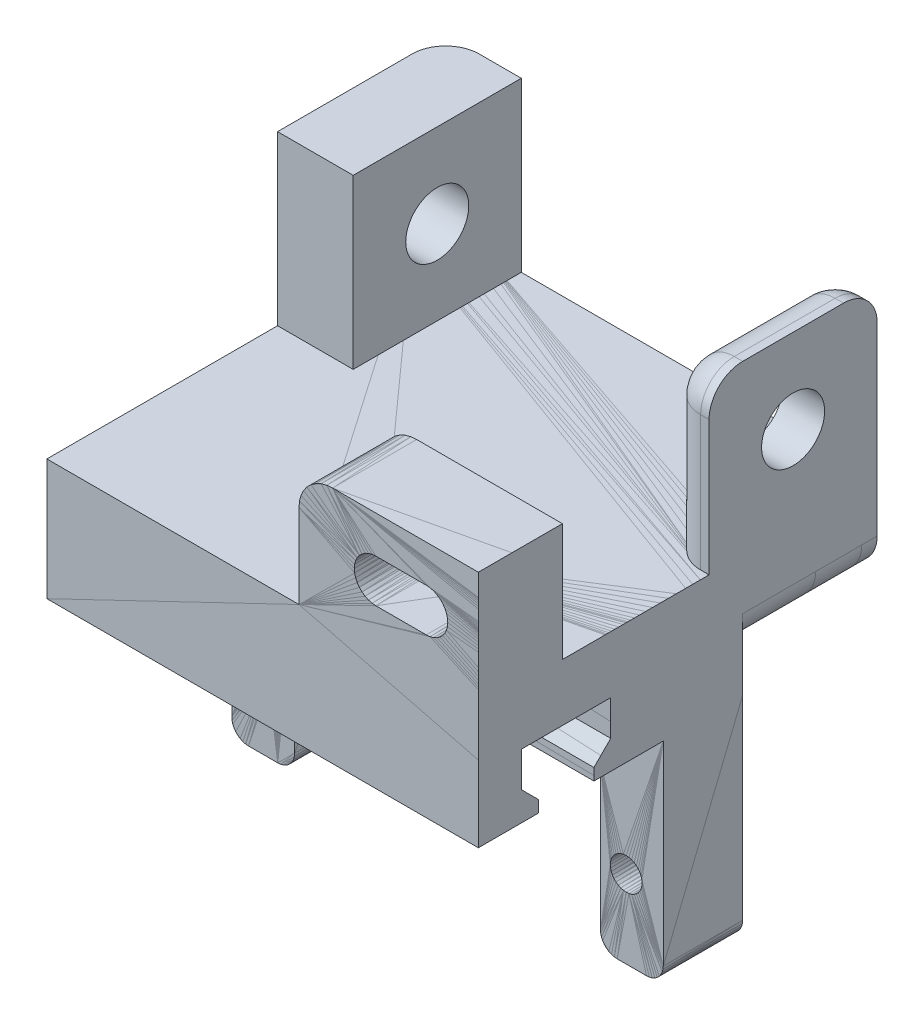
from build123d import *

# Parameters (mm, degrees)
CUT_EXTRUDE1_START       = 2.540050074
CUT_EXTRUDE1_OUTLINE_W   = 32.600000501
CUT_EXTRUDE1_OUTLINE_H   = 4.317998886
CUT_EXTRUDE1_DEPTH       = 27.590001002
CUT_EXTRUDE1_START_2     = 10.160050355
CUT_EXTRUDE1_2_DEPTH     = 6.000001915
CUT_EXTRUDE1_START_3     = 26.859140024
CUT_EXTRUDE1_3_OUTLINE_W = 32.600000501
CUT_EXTRUDE1_3_OUTLINE_H = 4.825999961
CUT_EXTRUDE1_3_DEPTH     = 3.270911052
CUT_EXTRUDE1_4_OUTLINE_W = 32.600000501
CUT_EXTRUDE1_4_OUTLINE_H = 2.032000572
CUT_EXTRUDE1_4_DEPTH     = 17.588090152
CUT_EXTRUDE1_START_4     = 16.16005227
CUT_EXTRUDE1_5_OUTLINE_W = 32.600000501
CUT_EXTRUDE1_5_OUTLINE_H = 2.793999389
CUT_EXTRUDE1_5_DEPTH     = 3.968087956
CUT_EXTRUDE1_START_5     = 23.780049756
CUT_EXTRUDE1_6_DEPTH     = 3.079090268
CUT_EXTRUDE1_START_6     = 78.40000093
CUT_EXTRUDE1_7_DEPTH     = 32.600000501
CUT_EXTRUDE1_START_7     = 19.86999996
CUT_EXTRUDE1_8_DEPTH     = 6.349999458
SKETCH2_W                = 3.175
SKETCH2_H                = 12.7
BOSS_EXTRUDE1_DEPTH      = 12.7
SKETCH3_R                = 2.38125
CUT_EXTRUDE2_DEPTH       = 40.64
FILLET1_R                = 2.54
FILLET2_R                = 2.54


with BuildPart() as part:
    # Cut-Extrude1: read off the stored shape, not the designer's step
    # Cut-Extrude1 outline → Cut-Extrude1 (new body)
    with BuildSketch(Plane.XY.offset(CUT_EXTRUDE1_START)):
        with Locations((94.700001181, 24.060999975)):
            Rectangle(CUT_EXTRUDE1_OUTLINE_W, CUT_EXTRUDE1_OUTLINE_H)
    extrude(amount=CUT_EXTRUDE1_DEPTH)

    # Cut-Extrude1 2 outline → Cut-Extrude1 2 (add)
    with BuildSketch(Plane.XY.offset(CUT_EXTRUDE1_START_2)):
        Polygon((111.000001431, 21.902000532), (78.40000093, 21.902000532), (78.40000093, 2.355000004), (78.419297934, 2.134466544), (78.476592898, 1.920634415), (78.570149839, 1.720000058), (78.697122633, 1.538659446), (78.853659332, 1.382123213), (79.034999013, 1.255147625), (79.235635698, 1.161590219), (79.449467361, 1.104293857), (79.669997096, 1.084999647), (81.876002252, 1.084999647), (82.096531987, 1.104293857), (82.31036365, 1.161590219), (82.511000335, 1.255147625), (82.692340016, 1.382123213), (82.848876715, 1.538659446), (82.975849509, 1.720000058), (83.06940645, 1.920634415), (83.126708865, 2.134466544), (83.145998418, 2.355000004), (83.145998418, 13.265999965), (106.253996491, 13.265999965), (106.253996491, 2.355000004), (106.273293495, 2.134466544), (106.33058846, 1.920634415), (106.424145401, 1.720000058), (106.551125646, 1.538659446), (106.707662344, 1.382123213), (106.889002025, 1.255147625), (107.08963871, 1.161590219), (107.303470373, 1.104293857), (107.524000108, 1.084999647), (109.729997814, 1.084999647), (109.950534999, 1.104293857), (110.164366663, 1.161590219), (110.365003347, 1.255147625), (110.546335578, 1.382123213), (110.702872276, 1.538659446), (110.829852521, 1.720000058), (110.923409462, 1.920634415), (110.980704427, 2.134466544), (111.000001431, 2.355000004), align=None)
        Polygon((107.789576054, 5.857368931), (107.600003481, 5.945769139), (107.428655028, 6.065746769), (107.280746102, 6.213654764), (107.160769403, 6.384999957), (107.072368264, 6.574575789), (107.018232346, 6.776622031), (107.000000775, 6.984999869), (107.018232346, 7.193377707), (107.072368264, 7.395423949), (107.160769403, 7.584999781), (107.280746102, 7.756344974), (107.428655028, 7.904252969), (107.600003481, 8.024230599), (107.789576054, 8.112630807), (107.991620898, 8.166769519), (108.199998736, 8.185000159), (108.408376575, 8.166769519), (108.610421419, 8.112630807), (108.800001442, 8.024230599), (108.971342444, 7.904252969), (109.11925137, 7.756344974), (109.23922807, 7.584999781), (109.327629209, 7.395423949), (109.381765127, 7.193377707), (109.400004148, 6.984999869), (109.381765127, 6.776622031), (109.327629209, 6.574575789), (109.23922807, 6.384999957), (109.11925137, 6.213654764), (108.971342444, 6.065746769), (108.800001442, 5.945769139), (108.610421419, 5.857368931), (108.408376575, 5.803230684), (108.199998736, 5.784999579), (107.991620898, 5.803230684), align=None, mode=Mode.SUBTRACT)
        Polygon((81.408381462, 5.803230684), (81.200003624, 5.784999579), (80.991625786, 5.803230684), (80.789573491, 5.857368931), (80.600000918, 5.945769139), (80.428652465, 6.065746769), (80.280743539, 6.213654764), (80.16076684, 6.384999957), (80.072365701, 6.574575789), (80.018229783, 6.776622031), (79.999998212, 6.984999869), (80.018229783, 7.193377707), (80.072365701, 7.395423949), (80.16076684, 7.584999781), (80.280743539, 7.756344974), (80.428652465, 7.904252969), (80.600000918, 8.024230599), (80.789573491, 8.112630807), (80.991625786, 8.166769519), (81.200003624, 8.185000159), (81.408381462, 8.166769519), (81.610426307, 8.112630807), (81.799998879, 8.024230599), (81.971347332, 7.904252969), (82.119256258, 7.756344974), (82.239232957, 7.584999781), (82.327634096, 7.395423949), (82.381770015, 7.193377707), (82.400001585, 6.984999869), (82.381770015, 6.776622031), (82.327634096, 6.574575789), (82.239232957, 6.384999957), (82.119256258, 6.213654764), (81.971347332, 6.065746769), (81.799998879, 5.945769139), (81.610426307, 5.857368931), align=None, mode=Mode.SUBTRACT)
    extrude(amount=CUT_EXTRUDE1_2_DEPTH)

    # Cut-Extrude1 3 outline → Cut-Extrude1 3 (add)
    # profile 1 of 2: a face of its own
    with BuildSketch(Plane.XY.offset(CUT_EXTRUDE1_START_3)):
        Polygon((99.990002811, 35.110000521), (99.54893589, 35.071410239), (99.121272564, 34.956820309), (98.719999194, 34.769706428), (98.357319832, 34.515753388), (98.044246435, 34.202679992), (97.790293396, 33.840000629), (97.603179514, 33.438730985), (97.488589585, 33.011067659), (97.450003028, 32.570000738), (97.450003028, 26.219999418), (111.000001431, 26.219999418), (111.000001431, 35.110000521), align=None)
        Polygon((108.309820294, 31.709529459), (108.472287655, 31.477499753), (108.592003584, 31.220782548), (108.665302396, 30.947178602), (108.69000107, 30.664999038), (108.665302396, 30.382821336), (108.592003584, 30.10921739), (108.472287655, 29.852500185), (108.309820294, 29.620468616), (108.109533787, 29.420178384), (107.877500355, 29.257707298), (107.62078315, 29.137998819), (107.347175479, 29.064686969), (107.06499964, 29.03999947), (103.255003691, 29.03999947), (102.972820401, 29.064686969), (102.699220181, 29.137998819), (102.442502975, 29.257707298), (102.210469544, 29.420178384), (102.010175586, 29.620468616), (101.847708225, 29.852500185), (101.727999747, 30.10921739), (101.654686034, 30.382821336), (101.63000226, 30.664999038), (101.654686034, 30.947178602), (101.727999747, 31.220782548), (101.847708225, 31.477499753), (102.010175586, 31.709529459), (102.210469544, 31.909823418), (102.442502975, 32.072290778), (102.699220181, 32.191999257), (102.972820401, 32.26531297), (103.255003691, 32.290000468), (107.06499964, 32.290000468), (107.347175479, 32.26531297), (107.62078315, 32.191999257), (107.877500355, 32.072290778), (108.109533787, 31.909823418), align=None, mode=Mode.SUBTRACT)
    # profile 2 of 2: a face of its own
    with BuildSketch(Plane.XY.offset(CUT_EXTRUDE1_START_3)):
        with Locations((94.700001181, 19.489000552)):
            Rectangle(CUT_EXTRUDE1_3_OUTLINE_W, CUT_EXTRUDE1_3_OUTLINE_H)
    extrude(amount=CUT_EXTRUDE1_3_DEPTH)

    # Cut-Extrude1 4 outline → Cut-Extrude1 4 (add)
    with BuildSketch(Plane.XY.offset(CUT_EXTRUDE1_START)):
        with Locations((94.700001181, 20.886000246)):
            Rectangle(CUT_EXTRUDE1_4_OUTLINE_W, CUT_EXTRUDE1_4_OUTLINE_H)
    extrude(amount=CUT_EXTRUDE1_4_DEPTH)

    # Cut-Extrude1 5 outline → Cut-Extrude1 5 (add)
    with BuildSketch(Plane.XY.offset(CUT_EXTRUDE1_START_4)):
        with Locations((94.700001181, 18.473000266)):
            Rectangle(CUT_EXTRUDE1_5_OUTLINE_W, CUT_EXTRUDE1_5_OUTLINE_H)
    extrude(amount=CUT_EXTRUDE1_5_DEPTH)

    # Cut-Extrude1 6 outline → Cut-Extrude1 6 (add)
    with BuildSketch(Plane.XY.offset(CUT_EXTRUDE1_START_5)):
        Polygon((99.990002811, 35.110000521), (99.54893589, 35.071410239), (99.121272564, 34.956820309), (98.719999194, 34.769706428), (98.357319832, 34.515753388), (98.044246435, 34.202679992), (97.790293396, 33.840000629), (97.603179514, 33.438730985), (97.488589585, 33.011067659), (97.450003028, 32.570000738), (97.450003028, 26.219999418), (111.000001431, 26.219999418), (111.000001431, 35.110000521), align=None)
        Polygon((108.309820294, 31.709529459), (108.472287655, 31.477499753), (108.592003584, 31.220782548), (108.665302396, 30.947178602), (108.69000107, 30.664999038), (108.665302396, 30.382821336), (108.592003584, 30.10921739), (108.472287655, 29.852500185), (108.309820294, 29.620468616), (108.109533787, 29.420178384), (107.877500355, 29.257707298), (107.62078315, 29.137998819), (107.347175479, 29.064686969), (107.06499964, 29.03999947), (103.255003691, 29.03999947), (102.972820401, 29.064686969), (102.699220181, 29.137998819), (102.442502975, 29.257707298), (102.210469544, 29.420178384), (102.010175586, 29.620468616), (101.847708225, 29.852500185), (101.727999747, 30.10921739), (101.654686034, 30.382821336), (101.63000226, 30.664999038), (101.654686034, 30.947178602), (101.727999747, 31.220782548), (101.847708225, 31.477499753), (102.010175586, 31.709529459), (102.210469544, 31.909823418), (102.442502975, 32.072290778), (102.699220181, 32.191999257), (102.972820401, 32.26531297), (103.255003691, 32.290000468), (107.06499964, 32.290000468), (107.347175479, 32.26531297), (107.62078315, 32.191999257), (107.877500355, 32.072290778), (108.109533787, 31.909823418), align=None, mode=Mode.SUBTRACT)
    extrude(amount=CUT_EXTRUDE1_6_DEPTH)

    # Cut-Extrude1 7 outline → Cut-Extrude1 7 (add)
    with BuildSketch(Plane.YZ.offset(CUT_EXTRUDE1_START_6)):
        Polygon((17.076000571, 25.589140132), (17.965000123, 25.589140132), (18.711520205, 26.335660214), (19.235000014, 26.859140024), (17.076000571, 26.859140024), align=None)
        Polygon((19.235000014, 20.128140226), (17.965000123, 21.398140118), (17.076000571, 21.398140118), (17.076000571, 20.128140226), align=None)
    extrude(amount=CUT_EXTRUDE1_7_DEPTH)

    # Cut-Extrude1 8 outline → Cut-Extrude1 8 (add)
    with BuildSketch(Plane(origin=(0, 0, 0), x_dir=(1, 0, 0), z_dir=(0, 1, 0)).offset(CUT_EXTRUDE1_START_7)):
        Polygon((78.994244337, -0.907369889), (78.740298748, -1.270050183), (78.553177416, -1.671318896), (78.438587487, -2.098984085), (78.40000093, -2.540050074), (111.000001431, -2.540050074), (111.000001431, -5.0291e-05), (80.940000713, -5.0291e-05), (80.498933792, -0.038638711), (80.071270466, -0.153230503), (79.669997096, -0.340346247), (79.307317734, -0.594297424), align=None)
    extrude(amount=CUT_EXTRUDE1_8_DEPTH)

    # Sketch2 → Boss-Extrude1 (add)
    with BuildSketch(Plane(origin=(0, 26.219999418, 0), x_dir=(1, 0, 0), z_dir=(0, 1, 0))):
        with Locations((109.412501431, -6.350050291)):
            Rectangle(SKETCH2_W, SKETCH2_H)
        with BuildLine():
            Line((80.940000713, -12.700050291), (84.115000713, -12.700050291))
            Line((84.115000713, -12.700050291), (84.115000713, -5.0291e-05))
            Line((84.115000713, -5.0291e-05), (80.940000713, -5.0291e-05))
            ThreePointArc((80.940000713, -5.0291e-05), (79.143947729, -0.743997091), (78.40000093, -2.540050074))
            Line((78.40000093, -2.540050074), (78.40000093, -12.700050291))
            Line((78.40000093, -12.700050291), (80.940000713, -12.700050291))
        make_face()
    extrude(amount=BOSS_EXTRUDE1_DEPTH)

    # Sketch3 → Cut-Extrude2 (cut)
    with BuildSketch(Plane(origin=(111.000001431, 0, 0), x_dir=(0, 0, -1), z_dir=(1, 0, 0))):
        with Locations(Location((-6.350050291, 32.569999418, 0), (0, 0, 180))):
            Circle(SKETCH3_R)
    extrude(amount=-CUT_EXTRUDE2_DEPTH, mode=Mode.SUBTRACT)

    # Fillet1
    fillet1_edges = [part.edges().sort_by_distance(p)[0] for p in [
        (107.825001431, 32.569999418, 5.0291e-05),
        (107.825001431, 32.569999418, 12.700050291),
        (109.412501431, 38.919999418, 5.0291e-05),
        (107.825001431, 38.919999418, 6.350050291),
        (109.412501431, 38.919999418, 12.700050291),
    ]]
    fillet(fillet1_edges, radius=FILLET1_R)

    # Fillet2
    fillet2_edges = [part.edges().sort_by_distance(p)[0] for p in [
        (111.000001431, 19.86999996, 5.080050323),
        (111.000001431, 19.86999996, 5.080050323),
        (111.000001431, 19.86999996, 5.080050323),
    ]]
    fillet(fillet2_edges, radius=FILLET2_R)


solid = part.part
